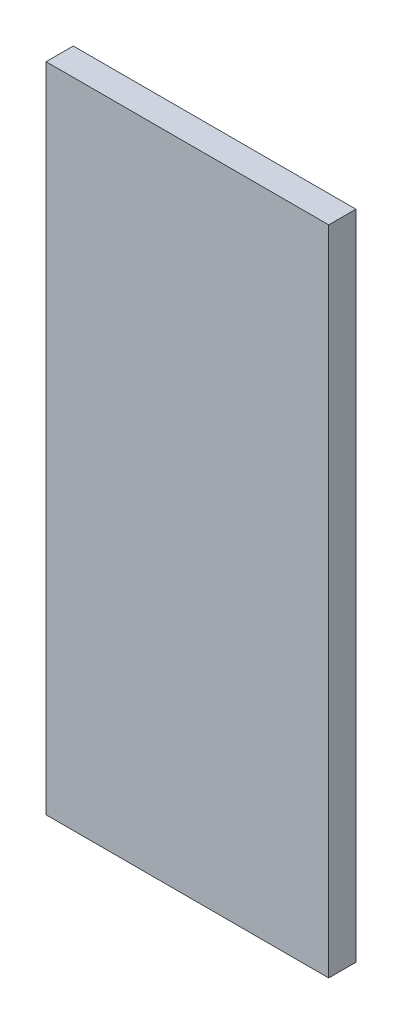
from build123d import *

# Parameters (mm, degrees)
SKETCH1_W           = 66.04
SKETCH1_H           = 152.4
BOSS_EXTRUDE1_DEPTH = 6.35


with BuildPart() as part:
    # Sketch1 → Boss-Extrude1 (new body)
    with BuildSketch(Plane.XY):
        with Locations((-1364.940453354, 35.459021407)):
            Rectangle(SKETCH1_W, SKETCH1_H)
    extrude(amount=BOSS_EXTRUDE1_DEPTH)


solid = part.part
